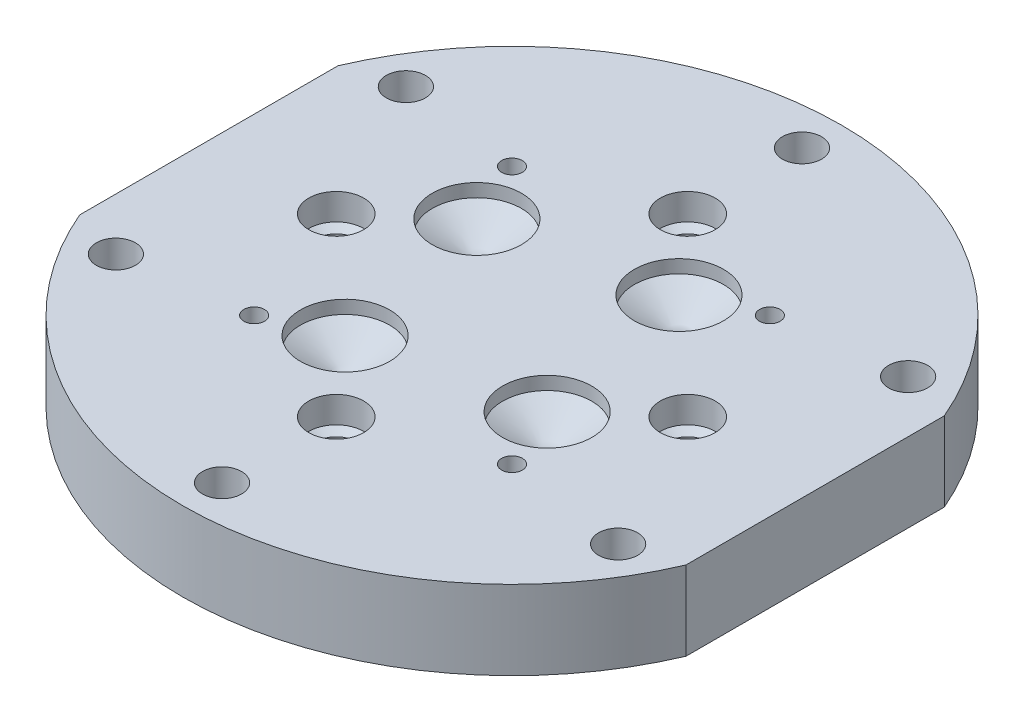
from build123d import *

# Parameters (mm, degrees)
OUTER_R                     = 19.05
BODY_DEPTH                  = 4.572
F_4_40_TAPPED_HOLE_D        = 2.2606
SCREW_HOLES_COUNT           = 6
F_0_80_TAPPED_HOLE_D        = 1.19126
INNER_SCREW_HOLES_COUNT     = 4
F_43_0_089_DIAMETER_HOLE1_D = 2.2606
IO_HOLES_PATTERN_COUNT      = 4
POST_BOTTOMS_COUNT          = 4
FLAT_CUT_DEPTH              = 28.325961721
FLAT_CUT_DEPTH_BACK         = 28.325961721
FLAT_CUT_SKETCH_W           = 3.048
FLAT_CUT_SKETCH_H           = 38.1


with BuildPart() as part:
    # outer → Body (new body)
    with BuildSketch(Plane(origin=(0, 0, 0), x_dir=(1, 0, 0), z_dir=(0, 1, 0))):
        Circle(OUTER_R)
    extrude(amount=-BODY_DEPTH)

    # #4-40 Tapped Hole (through all)
    with Locations(Plane(origin=(0, 0, 0), x_dir=(1, 0, 0), z_dir=(0, 1, 0))):
        with Locations((0, -16.764)):
            f_4_40_tapped_hole = Hole(F_4_40_TAPPED_HOLE_D / 2)

    # Screw Holes: #4-40 Tapped Hole ×6 about axis
    screw_holes_axis = Axis((0, 0.15875, 0), (0, -1, 0))
    for i in range(1, SCREW_HOLES_COUNT):
        add(f_4_40_tapped_hole.rotate(screw_holes_axis, i * 360 / SCREW_HOLES_COUNT), mode=Mode.SUBTRACT)

    # #0-80 Tapped Hole (through all)
    with Locations(Plane(origin=(0, 0, 0), x_dir=(1, 0, 0), z_dir=(0, 1, 0))):
        with Locations((-7.45361258, 7.45361258)):
            f_0_80_tapped_hole = Hole(F_0_80_TAPPED_HOLE_D / 2)

    # Inner Screw Holes: #0-80 Tapped Hole ×4 about axis
    inner_screw_holes_axis = Axis((0, 0.15875, 0), (0, -1, 0))
    for i in range(1, INNER_SCREW_HOLES_COUNT):
        add(f_0_80_tapped_hole.rotate(inner_screw_holes_axis, i * 360 / INNER_SCREW_HOLES_COUNT), mode=Mode.SUBTRACT)

    # #43 (0.089) Diameter Hole1 (through all)
    with Locations(Plane(origin=(0, 0, 0), x_dir=(1, 0, 0), z_dir=(0, 1, 0))):
        with Locations((0, 10.16)):
            f_43_0_089_diameter_hole1 = Hole(F_43_0_089_DIAMETER_HOLE1_D / 2)

    # Sketch40 → 1/8 (0.125) Diameter Hole1 (revolve, cut)
    with BuildSketch(Plane(origin=(0, 0, -10.16), x_dir=(0, 0, 1), z_dir=(1, 0, 0))):
        Polygon((0, 0), (0, 2.477866233), (1.5875, 1.524), (1.5875, 0), align=None)
    f_1_8_0_125_diameter_hole1 = revolve(axis=Axis((0, 6.35, -10.16), (0, -1, 0)), mode=Mode.SUBTRACT)

    # Sketch42 → 1/8 (0.125) Diameter Hole2 (revolve, cut)
    with BuildSketch(Plane(origin=(0, -4.572, -10.16), x_dir=(0, 0, -1), z_dir=(1, 0, 0))):
        Polygon((0, 0), (0, 2.477866233), (1.5875, 1.524), (1.5875, 0), align=None)
    f_1_8_0_125_diameter_hole2 = revolve(axis=Axis((0, -10.922, -10.16), (0, 1, 0)), mode=Mode.SUBTRACT)

    # IO Holes Pattern: #43 (0.089) Diameter Hole1, 1/8 (0.125) Diameter Hole1, 1/8 (0.125) Diameter Hole2 ×4 about axis
    io_holes_pattern_axis = Axis((0, 0.15875, 0), (0, -1, 0))
    add([f_43_0_089_diameter_hole1.rotate(io_holes_pattern_axis, i * 360 / IO_HOLES_PATTERN_COUNT) for i in range(1, IO_HOLES_PATTERN_COUNT)], mode=Mode.SUBTRACT)
    add([f_1_8_0_125_diameter_hole1.rotate(io_holes_pattern_axis, i * 360 / IO_HOLES_PATTERN_COUNT) for i in range(1, IO_HOLES_PATTERN_COUNT)], mode=Mode.SUBTRACT)
    add([f_1_8_0_125_diameter_hole2.rotate(io_holes_pattern_axis, i * 360 / IO_HOLES_PATTERN_COUNT) for i in range(1, IO_HOLES_PATTERN_COUNT)], mode=Mode.SUBTRACT)

    # Sketch45 → 13/64 (0.20313) Diameter Hole1 (revolve, cut)
    with BuildSketch(Plane(origin=(3.81, 0, -5.842), x_dir=(0, 0, 1), z_dir=(1, 0, 0))):
        Polygon((0, 0), (0, 2.312070783), (2.579751, 0.762), (2.579751, 0), align=None)
    f_13_64_0_20313_diameter_hole1 = revolve(axis=Axis((3.81, 6.35, -5.842), (0, -1, 0)), mode=Mode.SUBTRACT)

    # Post Bottoms: 13/64 (0.20313) Diameter Hole1 ×4 about axis
    post_bottoms_axis = Axis((0, 0.15875, 0), (0, -1, 0))
    for i in range(1, POST_BOTTOMS_COUNT):
        add(f_13_64_0_20313_diameter_hole1.rotate(post_bottoms_axis, i * 360 / POST_BOTTOMS_COUNT), mode=Mode.SUBTRACT)

    # Flat Cut Sketch → Flat Cut (cut, two sides: drawn at the far end of the back side and taken through both)
    with BuildSketch(Plane(origin=(0, 0, 0), x_dir=(1, 0, 0), z_dir=(0, 1, 0)).offset(-FLAT_CUT_DEPTH_BACK)):
        with Locations((-19.05, 0)):
            Rectangle(FLAT_CUT_SKETCH_W, FLAT_CUT_SKETCH_H)
        with Locations((19.05, 0)):
            Rectangle(FLAT_CUT_SKETCH_W, FLAT_CUT_SKETCH_H)
    extrude(amount=FLAT_CUT_DEPTH + FLAT_CUT_DEPTH_BACK, mode=Mode.SUBTRACT)


solid = part.part
